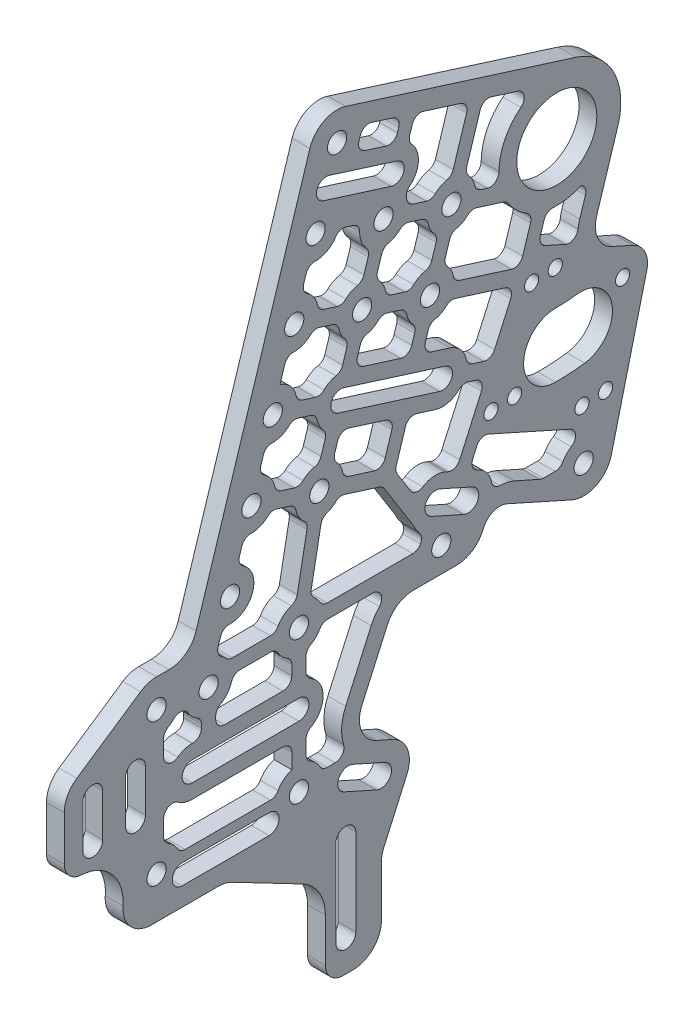
from build123d import *

# Parameters (mm, degrees)
BOSS_EXTRUDE1_DEPTH      = 3.175
BOSS_EXTRUDE1_DEPTH_BACK = 3.175
SKETCH2_R                = 14.2875
SKETCH2_R_2              = 3.429
SKETCH2_R_3              = 2.54
CUT_EXTRUDE2_DEPTH       = 287.611673302
FILLET1_START            = -3.175
FILLET1_DEPTH            = 6.35


with BuildPart() as part:
    # Sketch2 → Boss-Extrude1 (new, two sides: drawn at the far end of the back side and taken through both)
    with BuildSketch(Plane(origin=(0, 0, 0), x_dir=(0, 0, -1), z_dir=(1, 0, 0)).offset(-BOSS_EXTRUDE1_DEPTH_BACK)):
        with BuildLine():
            Line((38.021448917, 246.234864084), (120.241230069, 220.311066665))
            ThreePointArc((120.241230069, 220.311066665), (133.644163138, 209.06467047), (135.169064986, 191.634962595))
            Line((135.169064986, 191.634962595), (127.622152065, 167.6992128))
            ThreePointArc((127.622152065, 167.6992128), (128.044603019, 160.47960856), (133.162508812, 155.36999111))
            Line((133.162508812, 155.36999111), (140.48887895, 152.092017357))
            ThreePointArc((140.48887895, 152.092017357), (144.852236282, 147.866521475), (145.483799346, 141.825426314))
            Line((145.483799346, 141.825426314), (132.821367632, 91.06703794))
            ThreePointArc((132.821367632, 91.06703794), (127.408392323, 84.390132513), (118.814072234, 84.252183312))
            Line((118.814072234, 84.252183312), (95.644233558, 94.61886171))
            ThreePointArc((95.644233558, 94.61886171), (90.786060122, 94.754966448), (87.254572158, 91.415959651))
            Line((87.254572158, 91.415959651), (86.910445683, 90.646826606))
            ThreePointArc((86.910445683, 90.646826606), (83.162135594, 86.27028604), (77.636394916, 84.636234079))
            Line((77.636394916, 84.636234079), (62.21871433, 84.636234079))
            ThreePointArc((62.21871433, 84.636234079), (56.692973652, 83.002182118), (52.944663563, 78.625641552))
            Line((52.944663563, 78.625641552), (43.839685496, 58.275741142))
            ThreePointArc((43.839685496, 58.275741142), (43.621917914, 50.502663645), (48.96432879, 44.852282903))
            Line((48.96432879, 44.852282903), (54.760610519, 42.258903232))
            ThreePointArc((54.760610519, 42.258903232), (60.103021394, 36.60852249), (59.885253813, 28.835444993))
            Line((59.885253813, 28.835444993), (51.685949233, 10.509752126))
            ThreePointArc((51.685949233, 10.509752126), (51.023955621, 8.481811623), (50.8, 6.360344653))
            Line((50.8, 6.360344653), (50.8, -11.7475))
            ThreePointArc((50.8, -11.7475), (47.824204897, -18.931704897), (40.64, -21.9075))
            Line((40.64, -21.9075), (37.1475, -21.9075))
            ThreePointArc((37.1475, -21.9075), (32.657371939, -20.047628061), (30.7975, -15.5575))
            Line((30.7975, -15.5575), (30.7975, 0))
            ThreePointArc((30.7975, 0), (28.552596998, 8.032774411), (22.468409419, 13.737834946))
            Line((22.468409419, 13.737834946), (-2.554479623, 26.788416358))
            ThreePointArc((-2.554479623, 26.788416358), (-4.834094275, 27.647905305), (-7.252780881, 27.94))
            Line((-7.252780881, 27.94), (-31.256978796, 27.94))
            ThreePointArc((-31.256978796, 27.94), (-38.707276299, 31.19213006), (-41.38801938, 38.866561592))
            ThreePointArc((-41.38801938, 38.866561592), (-45.28789684, 50.537792221), (-56.355984579, 55.915905494))
            ThreePointArc((-56.355984579, 55.915905494), (-60.621662669, 57.889989399), (-62.361270294, 62.25654206))
            Line((-62.361270294, 62.25654206), (-62.361270294, 78.164314079))
            ThreePointArc((-62.361270294, 78.164314079), (-61.17251471, 82.933210558), (-57.884425091, 86.586151856))
            Line((-57.884425091, 86.586151856), (-35.119675091, 101.948071856))
            ThreePointArc((-35.119675091, 101.948071856), (-32.408029017, 103.24198088), (-29.436520294, 103.686234079))
            Line((-29.436520294, 103.686234079), (-25.026637608, 103.686234079))
            ThreePointArc((-25.026637608, 103.686234079), (-19.01893158, 105.6527569), (-15.336873388, 110.791063156))
            Line((-15.336873388, 110.791063156), (25.276513775, 239.600270788))
            ThreePointArc((25.276513775, 239.600270788), (30.274912084, 245.55712993), (38.021448917, 246.234864084))
        make_face()
        with Locations((113.367095492, 198.509097171)):
            Circle(SKETCH2_R, mode=Mode.SUBTRACT)
        with Locations((-29.436520294, 42.726234079)):
            Circle(SKETCH2_R_2, mode=Mode.SUBTRACT)
        with Locations((21.363479706, 93.526234079)):
            Circle(SKETCH2_R_2, mode=Mode.SUBTRACT)
        with Locations((122.963479706, 93.526234079)):
            Circle(SKETCH2_R_2, mode=Mode.SUBTRACT)
        with Locations((104.398969727, 158.50014909)):
            Circle(SKETCH2_R_3, mode=Mode.SUBTRACT)
        with Locations((136.858147411, 143.977222936)):
            Circle(SKETCH2_R_3, mode=Mode.SUBTRACT)
        with Locations((122.335221257, 111.518045252)):
            Circle(SKETCH2_R_3, mode=Mode.SUBTRACT)
        with Locations((89.876043573, 126.040971407)):
            Circle(SKETCH2_R_3, mode=Mode.SUBTRACT)
        with Locations((112.840572264, 159.063757816)):
            Circle(SKETCH2_R_3, mode=Mode.SUBTRACT)
        with Locations((130.776823793, 112.081653978)):
            Circle(SKETCH2_R_3, mode=Mode.SUBTRACT)
        with Locations((98.317646109, 126.604580132)):
            Circle(SKETCH2_R_3, mode=Mode.SUBTRACT)
        with Locations((-29.436520294, 93.526234079)):
            Circle(SKETCH2_R_2, mode=Mode.SUBTRACT)
        with Locations((21.363479706, 42.726234079)):
            Circle(SKETCH2_R_2, mode=Mode.SUBTRACT)
        with Locations((72.163479706, 93.526234079)):
            Circle(SKETCH2_R_2, mode=Mode.SUBTRACT)
        with Locations((34.966277994, 236.545099865)):
            Circle(SKETCH2_R_2, mode=Mode.SUBTRACT)
        with Locations((27.328350687, 212.320689316)):
            Circle(SKETCH2_R_2, mode=Mode.SUBTRACT)
        with Locations((19.690423379, 188.096278767)):
            Circle(SKETCH2_R_2, mode=Mode.SUBTRACT)
        with Locations((12.052496072, 163.871868218)):
            Circle(SKETCH2_R_2, mode=Mode.SUBTRACT)
        with Locations((4.414568765, 139.647457669)):
            Circle(SKETCH2_R_2, mode=Mode.SUBTRACT)
        with Locations((-3.223358543, 115.42304712)):
            Circle(SKETCH2_R_2, mode=Mode.SUBTRACT)
        with Locations((-10.86128585, 91.198636571)):
            Circle(SKETCH2_R_2, mode=Mode.SUBTRACT)
        with Locations((51.552761236, 204.682762008)):
            Circle(SKETCH2_R_2, mode=Mode.SUBTRACT)
        with Locations((43.914833928, 180.458351459)):
            Circle(SKETCH2_R_2, mode=Mode.SUBTRACT)
        with Locations((75.777171785, 197.044834701)):
            Circle(SKETCH2_R_2, mode=Mode.SUBTRACT)
        with Locations((68.139244477, 172.820424152)):
            Circle(SKETCH2_R_2, mode=Mode.SUBTRACT)
        with Locations((28.638979314, 132.009530361)):
            Circle(SKETCH2_R_2, mode=Mode.SUBTRACT)
        with BuildLine():
            Line((30.078004517, 221.041477113), (54.302415066, 213.403549806))
            ThreePointArc((54.302415066, 213.403549806), (58.763142366, 215.72565746), (56.441034713, 220.18638476))
            Line((56.441034713, 220.18638476), (32.216624164, 227.824312067))
            ThreePointArc((32.216624164, 227.824312067), (27.755896864, 225.502204413), (30.078004517, 221.041477113))
        make_face(mode=Mode.SUBTRACT)
        with BuildLine():
            Line((41.656, 20.2565), (41.656, -10.7315))
            ThreePointArc((41.656, -10.7315), (38.1, -14.2875), (34.544, -10.7315))
            Line((34.544, -10.7315), (34.544, 20.2565))
            ThreePointArc((34.544, 20.2565), (38.1, 23.8125), (41.656, 20.2565))
        make_face(mode=Mode.SUBTRACT)
        with BuildLine():
            Line((-20.2565, 41.656), (10.7315, 41.656))
            ThreePointArc((10.7315, 41.656), (14.2875, 38.1), (10.7315, 34.544))
            Line((10.7315, 34.544), (-20.2565, 34.544))
            ThreePointArc((-20.2565, 34.544), (-23.8125, 38.1), (-20.2565, 41.656))
        make_face(mode=Mode.SUBTRACT)
        with BuildLine():
            Line((-48.645270294, 78.164314079), (-48.645270294, 62.924314079))
            ThreePointArc((-48.645270294, 62.924314079), (-52.201270294, 59.368314079), (-55.757270294, 62.924314079))
            Line((-55.757270294, 62.924314079), (-55.757270294, 78.164314079))
            ThreePointArc((-55.757270294, 78.164314079), (-52.201270294, 81.720314079), (-48.645270294, 78.164314079))
        make_face(mode=Mode.SUBTRACT)
        with BuildLine():
            Line((-33.405270294, 78.164314079), (-33.405270294, 62.924314079))
            ThreePointArc((-33.405270294, 62.924314079), (-36.961270294, 59.368314079), (-40.517270294, 62.924314079))
            Line((-40.517270294, 62.924314079), (-40.517270294, 78.164314079))
            ThreePointArc((-40.517270294, 78.164314079), (-36.961270294, 81.720314079), (-33.405270294, 78.164314079))
        make_face(mode=Mode.SUBTRACT)
        with BuildLine():
            Line((37.346216444, 159.625358387), (73.682832268, 148.168467426))
            ThreePointArc((73.682832268, 148.168467426), (76.004939921, 143.707740126), (71.544212621, 141.385632472))
            Line((71.544212621, 141.385632472), (35.207596798, 152.842523433))
            ThreePointArc((35.207596798, 152.842523433), (32.885489144, 157.303250733), (37.346216444, 159.625358387))
        make_face(mode=Mode.SUBTRACT)
        with BuildLine():
            Line((-16.736520294, 71.682234079), (21.363479706, 71.682234079))
            ThreePointArc((21.363479706, 71.682234079), (24.919479706, 68.126234079), (21.363479706, 64.570234079))
            Line((21.363479706, 64.570234079), (-16.736520294, 64.570234079))
            ThreePointArc((-16.736520294, 64.570234079), (-20.292520294, 68.126234079), (-16.736520294, 71.682234079))
        make_face(mode=Mode.SUBTRACT)
        with BuildLine():
            Line((71.695223435, 111.204761595), (83.287786894, 106.018002254))
            ThreePointArc((83.287786894, 106.018002254), (85.209528129, 100.984205414), (80.175731289, 99.062464179))
            Line((80.175731289, 99.062464179), (68.583167831, 104.24922352))
            ThreePointArc((68.583167831, 104.24922352), (66.661426596, 109.28302036), (71.695223435, 111.204761595))
        make_face(mode=Mode.SUBTRACT)
        with BuildLine():
            Line((40.57466739, 41.649380844), (52.167230848, 36.462621503))
            ThreePointArc((52.167230848, 36.462621503), (54.088972084, 31.428824663), (49.055175244, 29.507083428))
            Line((49.055175244, 29.507083428), (37.462611785, 34.693842769))
            ThreePointArc((37.462611785, 34.693842769), (35.54087055, 39.727639609), (40.57466739, 41.649380844))
        make_face(mode=Mode.SUBTRACT)
        with BuildLine():
            ThreePointArc((112.879749334, 123.580682042), (118.115569936, 123.729709032), (123.328186485, 124.244155468))
            ThreePointArc((123.328186485, 124.244155468), (133.137248458, 137.092194354), (120.289209572, 146.901256326))
            ThreePointArc((120.289209572, 146.901256326), (116.666882818, 146.543759651), (113.028431213, 146.440198522))
            ThreePointArc((113.028431213, 146.440198522), (101.524332034, 135.084781222), (112.879749334, 123.580682042))
        make_face(mode=Mode.SUBTRACT)
    extrude(amount=BOSS_EXTRUDE1_DEPTH + BOSS_EXTRUDE1_DEPTH_BACK)

    # Sketch4 → Cut-Extrude2 (cut, through all)
    with BuildSketch(Plane(origin=(3.175, 0, 0), x_dir=(0, 0, -1), z_dir=(1, 0, 0))):
        with BuildLine():
            Line((98.39037992, 160.619013807), (75.120636428, 167.955935747))
            ThreePointArc((75.120636428, 167.955935747), (72.068263427, 165.272848972), (68.119638183, 164.31144674))
            Line((68.119638183, 164.31144674), (65.520653509, 156.068520459))
            Line((65.520653509, 156.068520459), (75.210417729, 153.013349536))
            ThreePointArc((75.210417729, 153.013349536), (79.595555225, 149.859540899), (81.24931684, 144.717458413))
            Line((81.24931684, 144.717458413), (90.036119582, 141.94699015))
            Line((90.036119582, 141.94699015), (98.39037992, 160.619013807))
        make_face()
        with BuildLine():
            Line((60.6757714, 157.59610592), (63.274756073, 165.839032202))
            ThreePointArc((63.274756073, 165.839032202), (60.591669298, 168.891405202), (59.630267066, 172.840030446))
            Line((59.630267066, 172.840030446), (50.896225879, 175.593863055))
            ThreePointArc((50.896225879, 175.593863055), (47.843852878, 172.91077628), (43.895227634, 171.949374048))
            Line((43.895227634, 171.949374048), (41.29624296, 163.706447766))
            Line((41.29624296, 163.706447766), (60.6757714, 157.59610592))
        make_face()
        with BuildLine():
            ThreePointArc((73.003732882, 179.801816102), (75.686819657, 176.749443102), (76.648221889, 172.800817857))
            Line((76.648221889, 172.800817857), (100.251556207, 165.358715133))
            Line((100.251556207, 165.358715133), (104.786020489, 179.740198481))
            ThreePointArc((104.786020489, 179.740198481), (99.495233646, 183.229115), (95.512628182, 188.159005223))
            Line((95.512628182, 188.159005223), (82.758563735, 192.180346296))
            ThreePointArc((82.758563735, 192.180346296), (79.706190735, 189.497259521), (75.75756549, 188.535857289))
            Line((75.75756549, 188.535857289), (73.003732882, 179.801816102))
        make_face()
        with BuildLine():
            Line((52.42381134, 180.438745165), (61.157852527, 177.684912556))
            ThreePointArc((61.157852527, 177.684912556), (64.210225527, 180.367999331), (68.158850772, 181.329401564))
            Line((68.158850772, 181.329401564), (70.91268338, 190.063442751))
            ThreePointArc((70.91268338, 190.063442751), (68.229596605, 193.115815751), (67.268194373, 197.064440995))
            Line((67.268194373, 197.064440995), (58.534153186, 199.818273604))
            ThreePointArc((58.534153186, 199.818273604), (55.481780186, 197.135186829), (51.533154941, 196.173784597))
            Line((51.533154941, 196.173784597), (48.779322333, 187.439743409))
            ThreePointArc((48.779322333, 187.439743409), (51.462409108, 184.387370409), (52.42381134, 180.438745165))
        make_face()
        with BuildLine():
            Line((77.435540738, 113.784316645), (87.947554498, 137.278984236))
            Line((87.947554498, 137.278984236), (79.721731379, 139.872576303))
            ThreePointArc((79.721731379, 139.872576303), (75.417671823, 136.608987617), (70.01662716, 136.540750362))
            Line((70.01662716, 136.540750362), (60.32686294, 139.595921285))
            Line((60.32686294, 139.595921285), (55.638222289, 124.725452965))
            Line((55.638222289, 124.725452965), (63.196259353, 112.646211684))
            ThreePointArc((63.196259353, 112.646211684), (67.895557701, 115.934864988), (73.614324392, 115.494010075))
            Line((73.614324392, 115.494010075), (77.435540738, 113.784316645))
        make_face()
        with BuildLine():
            Line((51.204741538, 127.557836839), (55.481980831, 141.123506747))
            Line((55.481980831, 141.123506747), (36.102452391, 147.233848593))
            Line((36.102452391, 147.233848593), (33.503467718, 138.990922311))
            ThreePointArc((33.503467718, 138.990922311), (36.186554493, 135.938549311), (37.147956725, 131.989924067))
            Line((37.147956725, 131.989924067), (51.204741538, 127.557836839))
        make_face()
        with BuildLine():
            Line((36.336498157, 164.869735306), (39.050345524, 173.476959509))
            ThreePointArc((39.050345524, 173.476959509), (36.367258749, 176.529332509), (35.405856517, 180.477957754))
            Line((35.405856517, 180.477957754), (26.67181533, 183.231790362))
            ThreePointArc((26.67181533, 183.231790362), (22.434832876, 180.042006763), (17.131717731, 179.981101233))
            Line((17.131717731, 179.981101233), (14.61120172, 171.987045752))
            ThreePointArc((14.61120172, 171.987045752), (18.920325355, 168.895412976), (20.561473484, 163.852261923))
            Line((20.561473484, 163.852261923), (29.168697687, 161.138414556))
            ThreePointArc((29.168697687, 161.138414556), (32.289245597, 163.894166466), (36.336498157, 164.869735306))
        make_face()
        with BuildLine():
            ThreePointArc((122.056050033, 179.789896461), (115.96602176, 178.035895455), (109.630902598, 178.21261302))
            Line((109.630902598, 178.21261302), (106.658778228, 168.786238815))
            Line((106.658778228, 168.786238815), (120.956635235, 162.389073628))
            ThreePointArc((120.956635235, 162.389073628), (120.860422247, 166.032726124), (121.566049428, 169.608694627))
            Line((121.566049428, 169.608694627), (124.530205964, 179.009798092))
            Line((124.530205964, 179.009798092), (122.056050033, 179.789896461))
        make_face()
        with BuildLine():
            Line((84.286149197, 197.025228406), (93.180003364, 194.221006959))
            ThreePointArc((93.180003364, 194.221006959), (95.373092197, 208.614652657), (106.522348099, 217.97845359))
            Line((106.522348099, 217.97845359), (86.983229243, 224.139114101))
            Line((86.983229243, 224.139114101), (80.641660189, 204.026226651))
            ThreePointArc((80.641660189, 204.026226651), (83.324746964, 200.973853651), (84.286149197, 197.025228406))
        make_face()
        with BuildLine():
            Line((28.658585608, 140.518507773), (31.372432975, 149.125731976))
            ThreePointArc((31.372432975, 149.125731976), (28.616681066, 152.246279886), (27.641112225, 156.293532446))
            Line((27.641112225, 156.293532446), (19.033888022, 159.007379813))
            ThreePointArc((19.033888022, 159.007379813), (14.796905569, 155.817596214), (9.493790424, 155.756690684))
            Line((9.493790424, 155.756690684), (6.973274413, 147.762635203))
            ThreePointArc((6.973274413, 147.762635203), (11.282398048, 144.671002427), (12.923546176, 139.627851374))
            Line((12.923546176, 139.627851374), (21.657587363, 136.874018766))
            ThreePointArc((21.657587363, 136.874018766), (24.709960364, 139.557105541), (28.658585608, 140.518507773))
        make_face()
        with BuildLine():
            Line((28.199400791, 188.076672472), (36.933441978, 185.322839864))
            ThreePointArc((36.933441978, 185.322839864), (39.985814978, 188.005926639), (43.934440223, 188.967328871))
            Line((43.934440223, 188.967328871), (46.688272831, 197.701370058))
            ThreePointArc((46.688272831, 197.701370058), (43.498489232, 201.938352511), (43.437583702, 207.241467656))
            Line((43.437583702, 207.241467656), (35.443528221, 209.761983668))
            ThreePointArc((35.443528221, 209.761983668), (31.257369637, 204.773114136), (24.769645039, 204.205511782))
            Line((24.769645039, 204.205511782), (22.249129027, 196.211456301))
            ThreePointArc((22.249129027, 196.211456301), (26.558252662, 193.119823525), (28.199400791, 188.076672472))
        make_face()
        with BuildLine():
            Line((60.061738648, 204.663155714), (68.795779835, 201.909323105))
            ThreePointArc((68.795779835, 201.909323105), (71.848152835, 204.59240988), (75.796778079, 205.553812113))
            Line((75.796778079, 205.553812113), (82.138347133, 225.666699563))
            Line((82.138347133, 225.666699563), (62.758818694, 231.777041409))
            Line((62.758818694, 231.777041409), (60.276198535, 223.903176217))
            ThreePointArc((60.276198535, 223.903176217), (63.972979357, 216.02106963), (58.928578059, 208.925450682))
            ThreePointArc((58.928578059, 208.925450682), (59.776109798, 206.868996082), (60.061738648, 204.663155714))
        make_face()
        with BuildLine():
            Line((86.123407556, 120.763365611), (82.072566121, 111.709612909))
            Line((82.072566121, 111.709612909), (85.20688785, 110.307250734))
            ThreePointArc((85.20688785, 110.307250734), (89.219725477, 106.581698347), (90.13174549, 101.182547868))
            ThreePointArc((90.13174549, 101.182547868), (94.247844944, 101.466045187), (98.237613228, 100.415143439))
            Line((98.237613228, 100.415143439), (107.957556727, 96.066234079))
            Line((107.957556727, 96.066234079), (114.842427989, 96.066234079))
            ThreePointArc((114.842427989, 96.066234079), (116.263438719, 98.77147304), (118.548531893, 100.800250632))
            ThreePointArc((118.548531893, 100.800250632), (120.069983463, 103.712435435), (118.197853141, 106.412576777))
            Line((118.197853141, 106.412576777), (86.123407556, 120.763365611))
        make_face()
        with BuildLine():
            ThreePointArc((63.906029369, 101.934694281), (62.925863328, 103.213577215), (62.204356677, 104.654304525))
            Line((62.204356677, 104.654304525), (51.206737664, 122.230679508))
            Line((51.206737664, 122.230679508), (35.620371264, 127.145041957))
            ThreePointArc((35.620371264, 127.145041957), (33.008334973, 124.708036533), (29.62615835, 123.557988576))
            Line((29.62615835, 123.557988576), (25.367878871, 101.034087856))
            ThreePointArc((25.367878871, 101.034087856), (27.915313996, 98.955465004), (29.484531424, 96.066234079))
            Line((29.484531424, 96.066234079), (64.042427989, 96.066234079))
            ThreePointArc((64.042427989, 96.066234079), (64.720102377, 97.649244499), (65.702609631, 99.063402928))
            Line((65.702609631, 99.063402928), (63.906029369, 101.934694281))
        make_face()
        with BuildLine():
            ThreePointArc((24.634580149, 124.501676585), (21.337485486, 127.640174701), (20.130001902, 132.029136656))
            Line((20.130001902, 132.029136656), (11.395960715, 134.782969264))
            ThreePointArc((11.395960715, 134.782969264), (7.158978261, 131.593185665), (1.855863117, 131.532280135))
            Line((1.855863117, 131.532280135), (-0.664652895, 123.538224654))
            ThreePointArc((-0.664652895, 123.538224654), (4.891818991, 112.864341472), (-5.782064191, 107.307869586))
            Line((-5.782064191, 107.307869586), (-8.302580202, 99.313814105))
            ThreePointArc((-8.302580202, 99.313814105), (-5.823456736, 98.055994576), (-3.882061288, 96.066234079))
            Line((-3.882061288, 96.066234079), (13.242427989, 96.066234079))
            ThreePointArc((13.242427989, 96.066234079), (15.934248781, 100.078068369), (20.37630067, 101.977775864))
            Line((20.37630067, 101.977775864), (24.634580149, 124.501676585))
        make_face()
        with BuildLine():
            Line((55.546179119, 225.7950596), (57.913936584, 233.30462687))
            Line((57.913936584, 233.30462687), (43.368178906, 237.89088665))
            ThreePointArc((43.368178906, 237.89088665), (43.037225534, 233.850125502), (40.873968492, 230.421189841))
            Line((40.873968492, 230.421189841), (55.546179119, 225.7950596))
        make_face()
        with BuildLine():
            ThreePointArc((47.148381834, 81.219021222), (53.239385728, 88.330899642), (62.21871433, 90.986234079))
            Line((62.21871433, 90.986234079), (29.484531424, 90.986234079))
            ThreePointArc((29.484531424, 90.986234079), (27.380251308, 87.509462478), (23.903479706, 85.405182362))
            Line((23.903479706, 85.405182362), (23.903479706, 76.380257098))
            ThreePointArc((23.903479706, 76.380257098), (29.999479706, 68.126234079), (23.903479706, 59.87221106))
            Line((23.903479706, 59.87221106), (23.903479706, 50.847285797))
            ThreePointArc((23.903479706, 50.847285797), (27.380251308, 48.74300568), (29.484531424, 45.266234079))
            Line((29.484531424, 45.266234079), (39.182521841, 45.266234079))
            ThreePointArc((39.182521841, 45.266234079), (36.64756034, 52.924189545), (38.043403766, 60.869120813))
            Line((38.043403766, 60.869120813), (47.148381834, 81.219021222))
        make_face()
        with BuildLine():
            ThreePointArc((18.823479706, 85.405182362), (15.346708105, 87.509462478), (13.242427989, 90.986234079))
            Line((13.242427989, 90.986234079), (-2.354937269, 90.986234079))
            ThreePointArc((-2.354937269, 90.986234079), (-4.068485442, 86.074093312), (-8.32128585, 83.077584853))
            Line((-8.32128585, 83.077584853), (-8.32128585, 76.762234079))
            Line((-8.32128585, 76.762234079), (18.823479706, 76.762234079))
            Line((18.823479706, 76.762234079), (18.823479706, 85.405182362))
        make_face()
        with BuildLine():
            Line((-13.40128585, 76.762234079), (-13.40128585, 83.077584853))
            ThreePointArc((-13.40128585, 83.077584853), (-16.201569996, 84.574102908), (-18.258291226, 86.992998394))
            ThreePointArc((-18.258291226, 86.992998394), (-20.623606881, 88.574093694), (-23.305909281, 87.625497717))
            ThreePointArc((-23.305909281, 87.625497717), (-24.961330476, 86.289124359), (-26.896520294, 85.405182362))
            Line((-26.896520294, 85.405182362), (-26.896520294, 77.650387375))
            ThreePointArc((-26.896520294, 77.650387375), (-25.156610021, 74.81822522), (-21.843832122, 75.090131113))
            ThreePointArc((-21.843832122, 75.090131113), (-19.423552227, 76.333569541), (-16.736520294, 76.762234079))
            Line((-16.736520294, 76.762234079), (-13.40128585, 76.762234079))
        make_face()
        with BuildLine():
            Line((18.823479706, 50.847285797), (18.823479706, 59.490234079))
            Line((18.823479706, 59.490234079), (-16.736520294, 59.490234079))
            ThreePointArc((-16.736520294, 59.490234079), (-19.423552227, 59.918898617), (-21.843832122, 61.162337046))
            ThreePointArc((-21.843832122, 61.162337046), (-25.156610021, 61.434242939), (-26.896520294, 58.602080783))
            Line((-26.896520294, 58.602080783), (-26.896520294, 50.847285797))
            ThreePointArc((-26.896520294, 50.847285797), (-23.419748692, 48.74300568), (-21.315468576, 45.266234079))
            Line((-21.315468576, 45.266234079), (13.242427989, 45.266234079))
            ThreePointArc((13.242427989, 45.266234079), (15.346708105, 48.74300568), (18.823479706, 50.847285797))
        make_face()
    extrude(amount=-CUT_EXTRUDE2_DEPTH, mode=Mode.SUBTRACT)

    # Fillet1: read off the stored shape, not the designer's step
    # Fillet1 outline → Fillet1 (add)
    with BuildSketch(Plane.YZ.offset(FILLET1_START)):
        with BuildLine():
            ThreePointArc((81.007727337, 8.32128585), (82.612389998, 7.885935964), (83.776996151, 6.699274981))
            ThreePointArc((83.776996151, 6.699274981), (83.385087471, 7.492082463), (83.077584853, 8.32128585))
            Line((83.077584853, 8.32128585), (81.007727337, 8.32128585))
        make_face()
        with BuildLine():
            ThreePointArc((90.986234079, 2.354937269), (89.846753449, 2.460363697), (88.731723887, 2.717734855))
            ThreePointArc((88.731723887, 2.717734855), (90.361055655, 1.570930172), (90.986234079, -0.320903576))
            Line((90.986234079, -0.320903576), (90.986234079, 2.354937269))
        make_face()
        with BuildLine():
            ThreePointArc((76.762234079, 5.14628585), (77.692170049, 7.391349881), (79.937234079, 8.32128585))
            Line((79.937234079, 8.32128585), (76.762234079, 8.32128585))
            Line((76.762234079, 8.32128585), (76.762234079, 5.14628585))
        make_face()
        with BuildLine():
            Line((90.986234079, -13.242427989), (90.986234079, -11.172570473))
            ThreePointArc((90.986234079, -11.172570473), (90.550884193, -12.777233134), (89.36422321, -13.941839287))
            ThreePointArc((89.36422321, -13.941839287), (90.157030692, -13.549930607), (90.986234079, -13.242427989))
        make_face()
        with BuildLine():
            ThreePointArc((79.937234079, -18.823479706), (77.692170049, -17.893543737), (76.762234079, -15.648479706))
            Line((76.762234079, -15.648479706), (76.762234079, -18.823479706))
            Line((76.762234079, -18.823479706), (79.937234079, -18.823479706))
        make_face()
        with BuildLine():
            ThreePointArc((85.405182362, -18.823479706), (85.712684979, -17.994276319), (86.104593659, -17.201468837))
            ThreePointArc((86.104593659, -17.201468837), (84.939987507, -18.38812982), (83.335324846, -18.823479706))
            Line((83.335324846, -18.823479706), (85.405182362, -18.823479706))
        make_face()
        with BuildLine():
            ThreePointArc((83.776996151, 15.02329672), (82.612389998, 13.836635737), (81.007727337, 13.40128585))
            Line((81.007727337, 13.40128585), (83.077584853, 13.40128585))
            ThreePointArc((83.077584853, 13.40128585), (83.385087471, 14.230489238), (83.776996151, 15.02329672))
        make_face()
        with BuildLine():
            ThreePointArc((79.937234079, 13.40128585), (77.692170049, 14.33122182), (76.762234079, 16.57628585))
            Line((76.762234079, 16.57628585), (76.762234079, 13.40128585))
            Line((76.762234079, 13.40128585), (79.937234079, 13.40128585))
        make_face()
        with BuildLine():
            Line((90.986234079, -62.21871433), (90.986234079, -47.738486431))
            ThreePointArc((90.986234079, -47.738486431), (89.086344764, -50.646186165), (85.660427628, -50.07400706))
            ThreePointArc((85.660427628, -50.07400706), (89.596272695, -55.58813877), (90.986234079, -62.21871433))
        make_face()
        with BuildLine():
            ThreePointArc((90.986234079, -29.484531424), (90.157030692, -29.177028806), (89.36422321, -28.785120127))
            ThreePointArc((89.36422321, -28.785120127), (90.550884193, -29.949726279), (90.986234079, -31.55438894))
            Line((90.986234079, -31.55438894), (90.986234079, -29.484531424))
        make_face()
        with BuildLine():
            Line((85.405182362, -23.903479706), (83.335324846, -23.903479706))
            ThreePointArc((83.335324846, -23.903479706), (84.939987507, -24.338829593), (86.104593659, -25.525490576))
            ThreePointArc((86.104593659, -25.525490576), (85.71268498, -24.732683093), (85.405182362, -23.903479706))
        make_face()
        with BuildLine():
            ThreePointArc((76.380257098, -23.903479706), (76.07444242, -24.740827803), (75.683937528, -25.542189384))
            ThreePointArc((75.683937528, -25.542189384), (76.84960336, -24.343671964), (78.462504973, -23.903479706))
            Line((78.462504973, -23.903479706), (76.380257098, -23.903479706))
        make_face()
        with BuildLine():
            Line((59.87221106, -23.903479706), (57.789963185, -23.903479706))
            ThreePointArc((57.789963185, -23.903479706), (59.402864798, -24.343671964), (60.56853063, -25.542189384))
            ThreePointArc((60.56853063, -25.542189384), (60.178025738, -24.740827803), (59.87221106, -23.903479706))
        make_face()
        with BuildLine():
            ThreePointArc((50.847285797, -23.903479706), (50.539783179, -24.732683094), (50.147874499, -25.525490576))
            ThreePointArc((50.147874499, -25.525490576), (51.312480651, -24.338829593), (52.917143312, -23.903479706))
            Line((52.917143312, -23.903479706), (50.847285797, -23.903479706))
        make_face()
        with BuildLine():
            Line((45.266234079, -29.484531424), (45.266234079, -31.55438894))
            ThreePointArc((45.266234079, -31.55438894), (45.701583966, -29.949726279), (46.888244949, -28.785120126))
            ThreePointArc((46.888244949, -28.785120126), (46.095437467, -29.177028806), (45.266234079, -29.484531424))
        make_face()
        with BuildLine():
            ThreePointArc((49.358185626, -37.307254546), (46.547916377, -36.816266415), (45.266234079, -34.267546524))
            Line((45.266234079, -34.267546524), (45.266234079, -39.182521841))
            ThreePointArc((45.266234079, -39.182521841), (47.248002458, -38.104783609), (49.358185626, -37.307254546))
        make_face()
        with BuildLine():
            ThreePointArc((50.847285797, 26.896520294), (50.539783179, 26.067316906), (50.147874499, 25.274509424))
            ThreePointArc((50.147874499, 25.274509424), (51.312480651, 26.461170407), (52.917143312, 26.896520294))
            Line((52.917143312, 26.896520294), (50.847285797, 26.896520294))
        make_face()
        with BuildLine():
            Line((45.266234079, 21.315468576), (45.266234079, 19.24561106))
            ThreePointArc((45.266234079, 19.24561106), (45.701583966, 20.850273721), (46.888244949, 22.014879874))
            ThreePointArc((46.888244949, 22.014879874), (46.095437467, 21.622971194), (45.266234079, 21.315468576))
        make_face()
        with BuildLine():
            ThreePointArc((45.266234079, -13.242427989), (46.095437467, -13.549930607), (46.888244949, -13.941839287))
            ThreePointArc((46.888244949, -13.941839287), (45.701583966, -12.777233134), (45.266234079, -11.172570473))
            Line((45.266234079, -11.172570473), (45.266234079, -13.242427989))
        make_face()
        with BuildLine():
            ThreePointArc((59.490234079, -15.648479706), (58.560298109, -17.893543737), (56.315234079, -18.823479706))
            Line((56.315234079, -18.823479706), (59.490234079, -18.823479706))
            Line((59.490234079, -18.823479706), (59.490234079, -15.648479706))
        make_face()
        with BuildLine():
            ThreePointArc((83.335324846, 26.896520294), (84.939987507, 26.461170407), (86.104593659, 25.274509424))
            ThreePointArc((86.104593659, 25.274509424), (85.712684979, 26.067316907), (85.405182362, 26.896520294))
            Line((85.405182362, 26.896520294), (83.335324846, 26.896520294))
        make_face()
        with BuildLine():
            ThreePointArc((122.537557783, -1.444276728), (124.126326291, -0.195198837), (126.146966854, -0.157880361))
            Line((126.146966854, -0.157880361), (123.538224654, 0.664652895))
            ThreePointArc((123.538224654, 0.664652895), (123.110553002, -0.424289236), (122.537557783, -1.444276728))
        make_face()
        with BuildLine():
            Line((131.532280135, -1.855863117), (128.923537934, -1.03332986))
            ThreePointArc((128.923537934, -1.03332986), (130.557344783, -2.222891179), (131.14234611, -4.157356066))
            ThreePointArc((131.14234611, -4.157356066), (131.258016697, -2.993174671), (131.532280135, -1.855863117))
        make_face()
        with BuildLine():
            ThreePointArc((104.699127385, 6.604597447), (106.332934234, 5.415036128), (106.917935561, 3.480571241))
            ThreePointArc((106.917935561, 3.480571241), (107.033606147, 4.644752636), (107.307869586, 5.782064191))
            Line((107.307869586, 5.782064191), (104.699127385, 6.604597447))
        make_face()
        with BuildLine():
            ThreePointArc((134.782969264, -11.395960715), (134.084611758, -10.853343988), (133.446347037, -10.241172229))
            ThreePointArc((133.446347037, -10.241172229), (134.227881907, -11.708712697), (134.160551105, -13.370018913))
            Line((134.160551105, -13.370018913), (134.782969264, -11.395960715))
        make_face()
        with BuildLine():
            ThreePointArc((98.313147234, 6.193650579), (99.901915742, 7.44272847), (101.922556305, 7.480046946))
            Line((101.922556305, 7.480046946), (99.313814105, 8.302580202))
            ThreePointArc((99.313814105, 8.302580202), (98.886142453, 7.213638072), (98.313147234, 6.193650579))
        make_face()
        with BuildLine():
            Line((132.029136656, -20.130001902), (132.651554815, -18.155943704))
            ThreePointArc((132.651554815, -18.155943704), (131.75382288, -19.555425448), (130.271880362, -20.309294237))
            ThreePointArc((130.271880362, -20.309294237), (131.145843509, -20.173926093), (132.029136656, -20.130001902))
        make_face()
        with BuildLine():
            ThreePointArc((96.066234079, 2.385881357), (96.324082143, 3.639216739), (97.055745626, 4.688980404))
            ThreePointArc((97.055745626, 4.688980404), (96.576146434, 4.266934581), (96.066234079, 3.882061288))
            Line((96.066234079, 3.882061288), (96.066234079, 2.385881357))
        make_face()
        with BuildLine():
            ThreePointArc((124.501676585, -24.634580149), (124.957864116, -23.876933098), (125.49022745, -23.170728172))
            ThreePointArc((125.49022745, -23.170728172), (124.125451776, -24.120390816), (122.467846731, -24.25007233))
            Line((122.467846731, -24.25007233), (124.501676585, -24.634580149))
        make_face()
        with BuildLine():
            ThreePointArc((97.688244949, -13.941839287), (96.501583966, -12.777233134), (96.066234079, -11.172570473))
            Line((96.066234079, -11.172570473), (96.066234079, -13.242427989))
            ThreePointArc((96.066234079, -13.242427989), (96.895437467, -13.549930607), (97.688244949, -13.941839287))
        make_face()
        with BuildLine():
            Line((101.977775864, -20.37630067), (104.011605718, -20.760808488))
            ThreePointArc((104.011605718, -20.760808488), (102.515746527, -20.034945513), (101.591851853, -18.652595915))
            ThreePointArc((101.591851853, -18.652595915), (101.829662858, -19.504406952), (101.977775864, -20.37630067))
        make_face()
        with BuildLine():
            ThreePointArc((137.836133826, -34.840089945), (139.303674294, -34.058555075), (140.96498051, -34.125885877))
            Line((140.96498051, -34.125885877), (138.990922311, -33.503467718))
            ThreePointArc((138.990922311, -33.503467718), (138.448305585, -34.201825223), (137.836133826, -34.840089945))
        make_face()
        with BuildLine():
            Line((147.233848593, -36.102452391), (144.205797274, -35.147711478))
            ThreePointArc((144.205797274, -35.147711478), (146.067315756, -36.70971095), (146.279107679, -39.13050371))
            Line((146.279107679, -39.13050371), (147.233848593, -36.102452391))
        make_face()
        with BuildLine():
            ThreePointArc((131.367505907, -39.122014924), (132.265237842, -37.722533179), (133.747180361, -36.96866439))
            ThreePointArc((133.747180361, -36.96866439), (132.873217214, -37.104032534), (131.989924067, -37.147956725))
            Line((131.989924067, -37.147956725), (131.367505907, -39.122014924))
        make_face()
        with BuildLine():
            Line((141.123506747, -55.481980831), (142.07824766, -52.453929512))
            ThreePointArc((142.07824766, -52.453929512), (140.516248189, -54.315447994), (138.095455428, -54.527239917))
            Line((138.095455428, -54.527239917), (141.123506747, -55.481980831))
        make_face()
        with BuildLine():
            ThreePointArc((130.585888158, -52.159482452), (128.724369676, -50.59748298), (128.512577753, -48.17669022))
            Line((128.512577753, -48.17669022), (127.557836839, -51.204741538))
            Line((127.557836839, -51.204741538), (130.585888158, -52.159482452))
        make_face()
        with BuildLine():
            ThreePointArc((114.900867739, -65.563324581), (114.480570337, -63.156986273), (115.893576634, -61.164368104))
            Line((115.893576634, -61.164368104), (112.646211684, -63.196259353))
            ThreePointArc((112.646211684, -63.196259353), (113.888281541, -64.270499094), (114.900867739, -65.563324581))
        make_face()
        with BuildLine():
            Line((124.725452965, -55.638222289), (123.483655151, -56.415220917))
            ThreePointArc((123.483655151, -56.415220917), (124.766137993, -55.95726755), (126.122506267, -56.078711503))
            Line((126.122506267, -56.078711503), (124.725452965, -55.638222289))
        make_face()
        with BuildLine():
            ThreePointArc((116.68245751, -78.732230573), (115.012954111, -76.966486591), (115.08100648, -74.537399873))
            Line((115.08100648, -74.537399873), (113.784316645, -77.435540738))
            Line((113.784316645, -77.435540738), (116.68245751, -78.732230573))
        make_face()
        with BuildLine():
            Line((139.595921285, -60.32686294), (136.567869967, -59.372122027))
            ThreePointArc((136.567869967, -59.372122027), (138.429388449, -60.934121499), (138.641180372, -63.354914259))
            Line((138.641180372, -63.354914259), (139.595921285, -60.32686294))
        make_face()
        with BuildLine():
            ThreePointArc((138.350651512, -84.548660135), (136.623985605, -86.489954617), (134.025910358, -86.492060087))
            Line((134.025910358, -86.492060087), (137.278984236, -87.947554498))
            Line((137.278984236, -87.947554498), (138.350651512, -84.548660135))
        make_face()
        with BuildLine():
            ThreePointArc((139.872576303, -79.721731379), (139.165943477, -79.178275308), (138.519098439, -78.564870099))
            ThreePointArc((138.519098439, -78.564870099), (139.311622342, -80.0369865), (139.246432291, -81.707606473))
            Line((139.246432291, -81.707606473), (139.872576303, -79.721731379))
        make_face()
        with BuildLine():
            Line((111.709612909, -82.072566121), (110.412923073, -84.970706986))
            ThreePointArc((110.412923073, -84.970706986), (112.178667055, -83.301203587), (114.607753773, -83.369255956))
            Line((114.607753773, -83.369255956), (111.709612909, -82.072566121))
        make_face()
        with BuildLine():
            Line((120.763365611, -86.123407556), (117.865224747, -84.826717721))
            ThreePointArc((117.865224747, -84.826717721), (119.534728145, -86.592461703), (119.466675776, -89.021548421))
            Line((119.466675776, -89.021548421), (120.763365611, -86.123407556))
        make_face()
        with BuildLine():
            ThreePointArc((97.688244949, -115.541839287), (96.501583966, -114.377233134), (96.066234079, -112.772570473))
            Line((96.066234079, -112.772570473), (96.066234079, -114.842427989))
            ThreePointArc((96.066234079, -114.842427989), (96.895437466, -115.149930607), (97.688244949, -115.541839287))
        make_face()
        with BuildLine():
            ThreePointArc((96.066234079, -108.63545805), (96.136220211, -107.972499622), (96.343093214, -107.338768214))
            Line((96.343093214, -107.338768214), (96.066234079, -107.957556727))
            Line((96.066234079, -107.957556727), (96.066234079, -108.63545805))
        make_face()
        with BuildLine():
            ThreePointArc((101.521900861, -93.182189978), (102.263766438, -91.17509556), (104.110726227, -90.094571579))
            ThreePointArc((104.110726227, -90.094571579), (102.648248262, -90.240073481), (101.182547868, -90.13174549))
            ThreePointArc((101.182547868, -90.13174549), (101.444714954, -91.646678427), (101.521900861, -93.182189978))
        make_face()
        with BuildLine():
            ThreePointArc((100.04553699, -26.831730848), (101.410312664, -25.882068204), (103.067917709, -25.75238669))
            Line((103.067917709, -25.75238669), (101.034087856, -25.367878871))
            ThreePointArc((101.034087856, -25.367878871), (100.577900325, -26.125525922), (100.04553699, -26.831730848))
        make_face()
        with BuildLine():
            Line((123.557988576, -29.62615835), (121.524158722, -29.241650532))
            ThreePointArc((121.524158722, -29.241650532), (123.020017914, -29.967513507), (123.943912588, -31.349863105))
            ThreePointArc((123.943912588, -31.349863105), (123.706101582, -30.498052068), (123.557988576, -29.62615835))
        make_face()
        with BuildLine():
            ThreePointArc((96.066234079, -31.55438894), (96.501583966, -29.949726279), (97.688244949, -28.785120126))
            ThreePointArc((97.688244949, -28.785120126), (96.895437466, -29.177028806), (96.066234079, -29.484531424))
            Line((96.066234079, -29.484531424), (96.066234079, -31.55438894))
        make_face()
        with BuildLine():
            ThreePointArc((127.145041957, -35.620371264), (126.446684451, -35.077754537), (125.80841973, -34.465582778))
            ThreePointArc((125.80841973, -34.465582778), (126.5899546, -35.933123246), (126.522623798, -37.594429462))
            Line((126.522623798, -37.594429462), (127.145041957, -35.620371264))
        make_face()
        with BuildLine():
            ThreePointArc((97.649453405, -64.719725235), (96.490367975, -63.557928691), (96.066234079, -61.972570473))
            Line((96.066234079, -61.972570473), (96.066234079, -64.042427989))
            ThreePointArc((96.066234079, -64.042427989), (97.649244499, -64.720102377), (99.063402928, -65.702609631))
            Line((99.063402928, -65.702609631), (100.818082689, -64.604698399))
            ThreePointArc((100.818082689, -64.604698399), (99.249154721, -65.086066524), (97.649453405, -64.719725235))
        make_face()
        with BuildLine():
            Line((122.230679508, -51.206737664), (122.582576394, -50.09066333))
            ThreePointArc((122.582576394, -50.09066333), (122.065547968, -51.078958451), (121.238635277, -51.827464322))
            Line((121.238635277, -51.827464322), (122.230679508, -51.206737664))
        make_face()
        with BuildLine():
            ThreePointArc((144.528923665, -91.191331527), (142.929578105, -89.594576074), (142.797562182, -87.338449749))
            Line((142.797562182, -87.338449749), (141.94699015, -90.036119582))
            Line((141.94699015, -90.036119582), (144.528923665, -91.191331527))
        make_face()
        with BuildLine():
            Line((144.717458413, -81.24931684), (144.091314401, -83.235191935))
            ThreePointArc((144.091314401, -83.235191935), (144.996142087, -81.829308692), (146.489710942, -81.077994568))
            ThreePointArc((146.489710942, -81.077994568), (145.608011734, -81.209451627), (144.717458413, -81.24931684))
        make_face()
        with BuildLine():
            ThreePointArc((161.690681083, -94.991485558), (159.964015175, -96.932780039), (157.365939929, -96.934885509))
            Line((157.365939929, -96.934885509), (160.619013807, -98.39037992))
            Line((160.619013807, -98.39037992), (161.690681083, -94.991485558))
        make_face()
        with BuildLine():
            ThreePointArc((166.61931352, -73.965847942), (167.40084839, -75.43338841), (167.333517588, -77.094694626))
            Line((167.333517588, -77.094694626), (167.955935747, -75.120636428))
            ThreePointArc((167.955935747, -75.120636428), (167.257578241, -74.578019701), (166.61931352, -73.965847942))
        make_face()
        with BuildLine():
            Line((156.068520459, -65.520653509), (155.113779545, -68.548704828))
            ThreePointArc((155.113779545, -68.548704828), (156.675779017, -66.687186346), (159.096571777, -66.475394423))
            Line((159.096571777, -66.475394423), (156.068520459, -65.520653509))
        make_face()
        with BuildLine():
            ThreePointArc((162.337388542, -67.497220024), (163.736870286, -68.394951958), (164.490739075, -69.876894477))
            ThreePointArc((164.490739075, -69.876894477), (164.355370932, -69.00293133), (164.31144674, -68.119638183))
            Line((164.31144674, -68.119638183), (162.337388542, -67.497220024))
        make_face()
        with BuildLine():
            ThreePointArc((166.853142725, -120.950376826), (164.503820993, -119.348181874), (164.379828947, -116.507237095))
            Line((164.379828947, -116.507237095), (162.389073628, -120.956635235))
            ThreePointArc((162.389073628, -120.956635235), (164.620895678, -120.801932509), (166.853142725, -120.950376826))
        make_face()
        with BuildLine():
            Line((168.786238815, -106.658778228), (167.631026871, -109.240711743))
            ThreePointArc((167.631026871, -109.240711743), (169.227782324, -107.641366183), (171.483908649, -107.50935026))
            Line((171.483908649, -107.50935026), (168.786238815, -106.658778228))
        make_face()
        with BuildLine():
            ThreePointArc((179.789896461, -122.056050033), (178.188762665, -123.502532812), (176.032837446, -123.591573878))
            Line((176.032837446, -123.591573878), (179.009798092, -124.530205964))
            Line((179.009798092, -124.530205964), (179.789896461, -122.056050033))
        make_face()
        with BuildLine():
            Line((178.21261302, -109.630902598), (175.698678514, -108.838262093))
            ThreePointArc((175.698678514, -108.838262093), (177.362317543, -110.070565245), (177.912625544, -112.066417689))
            ThreePointArc((177.912625544, -112.066417689), (178.026387597, -110.844197411), (178.21261302, -109.630902598))
        make_face()
        with BuildLine():
            ThreePointArc((166.993820687, -61.938133846), (165.526280219, -62.719668716), (163.864974003, -62.652337914))
            Line((163.864974003, -62.652337914), (165.839032202, -63.274756073))
            ThreePointArc((165.839032202, -63.274756073), (166.381648928, -62.576398568), (166.993820687, -61.938133846))
        make_face()
        with BuildLine():
            Line((157.59610592, -60.6757714), (160.624157239, -61.630512313))
            ThreePointArc((160.624157239, -61.630512313), (158.762638757, -60.068512841), (158.550846834, -57.647720081))
            Line((158.550846834, -57.647720081), (157.59610592, -60.6757714))
        make_face()
        with BuildLine():
            ThreePointArc((173.462448606, -57.656208867), (172.564716671, -59.055690612), (171.082774152, -59.809559401))
            ThreePointArc((171.082774152, -59.809559401), (171.956737299, -59.674191257), (172.840030446, -59.630267066))
            Line((172.840030446, -59.630267066), (173.462448606, -57.656208867))
        make_face()
        with BuildLine():
            Line((163.706447766, -41.29624296), (162.751706853, -44.324294279))
            ThreePointArc((162.751706853, -44.324294279), (164.313706324, -42.462775797), (166.734499085, -42.250983874))
            Line((166.734499085, -42.250983874), (163.706447766, -41.29624296))
        make_face()
        with BuildLine():
            ThreePointArc((174.257240828, -49.741437393), (175.038775698, -51.208977861), (174.971444896, -52.870284077))
            Line((174.971444896, -52.870284077), (175.593863055, -50.896225879))
            ThreePointArc((175.593863055, -50.896225879), (174.895505549, -50.353609152), (174.257240828, -49.741437393))
        make_face()
        with BuildLine():
            Line((171.949374048, -43.895227634), (169.975315849, -43.272809475))
            ThreePointArc((169.975315849, -43.272809475), (171.374797594, -44.170541409), (172.128666382, -45.652483928))
            ThreePointArc((172.128666382, -45.652483928), (171.99329824, -44.77852078), (171.949374048, -43.895227634))
        make_face()
        with BuildLine():
            ThreePointArc((194.199726398, -50.910736782), (195.599208142, -51.808468716), (196.353076931, -53.290411235))
            ThreePointArc((196.353076931, -53.290411235), (196.217708788, -52.416448087), (196.173784597, -51.533154941))
            Line((196.173784597, -51.533154941), (194.199726398, -50.910736782))
        make_face()
        with BuildLine():
            ThreePointArc((199.818273604, -58.534153186), (199.119916098, -57.991536459), (198.481651377, -57.3793647))
            ThreePointArc((198.481651377, -57.3793647), (199.263186247, -58.846905168), (199.195855445, -60.508211384))
            Line((199.195855445, -60.508211384), (199.818273604, -58.534153186))
        make_face()
        with BuildLine():
            ThreePointArc((186.284954924, -50.11594456), (187.752495392, -49.33440969), (189.413801608, -49.401740492))
            Line((189.413801608, -49.401740492), (187.439743409, -48.779322333))
            ThreePointArc((187.439743409, -48.779322333), (186.897126683, -49.477679838), (186.284954924, -50.11594456))
        make_face()
        with BuildLine():
            Line((197.064440995, -67.268194373), (197.686859155, -65.294136175))
            ThreePointArc((197.686859155, -65.294136175), (196.78912722, -66.693617919), (195.307184701, -67.447486708))
            ThreePointArc((195.307184701, -67.447486708), (196.181147848, -67.312118564), (197.064440995, -67.268194373))
        make_face()
        with BuildLine():
            ThreePointArc((179.816327005, -54.397869538), (180.71405894, -52.998387794), (182.196001459, -52.244519005))
            ThreePointArc((182.196001459, -52.244519005), (181.322038312, -52.379887149), (180.438745165, -52.42381134))
            Line((180.438745165, -52.42381134), (179.816327005, -54.397869538))
        make_face()
        with BuildLine():
            ThreePointArc((190.063442751, -70.91268338), (190.606059477, -70.214325875), (191.218231236, -69.576061153))
            ThreePointArc((191.218231236, -69.576061153), (189.750690768, -70.357596023), (188.089384552, -70.290265221))
            Line((188.089384552, -70.290265221), (190.063442751, -70.91268338))
        make_face()
        with BuildLine():
            ThreePointArc((179.021534783, -62.312641013), (178.239999913, -60.845100545), (178.307330715, -59.183794329))
            Line((178.307330715, -59.183794329), (177.684912556, -61.157852527))
            ThreePointArc((177.684912556, -61.157852527), (178.383270062, -61.700469254), (179.021534783, -62.312641013))
        make_face()
        with BuildLine():
            Line((181.329401564, -68.158850772), (183.303459762, -68.781268931))
            ThreePointArc((183.303459762, -68.781268931), (181.903978018, -67.883536997), (181.150109229, -66.401594478))
            ThreePointArc((181.150109229, -66.401594478), (181.285477372, -67.275557625), (181.329401564, -68.158850772))
        make_face()
        with BuildLine():
            ThreePointArc((174.631747995, -37.713723297), (173.164207527, -38.495258167), (171.502901311, -38.427927365))
            Line((171.502901311, -38.427927365), (173.476959509, -39.050345524))
            ThreePointArc((173.476959509, -39.050345524), (174.019576236, -38.351988018), (174.631747995, -37.713723297))
        make_face()
        with BuildLine():
            Line((164.869735306, -36.336498157), (166.8556104, -36.962642169))
            ThreePointArc((166.8556104, -36.962642169), (165.449727157, -36.057814482), (164.698413033, -34.564245628))
            ThreePointArc((164.698413033, -34.564245628), (164.829870093, -35.445944836), (164.869735306, -36.336498157))
        make_face()
        with BuildLine():
            ThreePointArc((181.100375913, -33.431798318), (180.202643978, -34.831280063), (178.72070146, -35.585148852))
            ThreePointArc((178.72070146, -35.585148852), (179.594664607, -35.449780708), (180.477957754, -35.405856517))
            Line((180.477957754, -35.405856517), (181.100375913, -33.431798318))
        make_face()
        with BuildLine():
            ThreePointArc((161.138414556, -29.168697687), (161.845047383, -29.712153758), (162.49189242, -30.325558967))
            ThreePointArc((162.49189242, -30.325558967), (161.699368517, -28.853442565), (161.764558568, -27.182822592))
            Line((161.764558568, -27.182822592), (161.138414556, -29.168697687))
        make_face()
        with BuildLine():
            ThreePointArc((181.895168135, -25.517026844), (182.676703005, -26.984567312), (182.609372203, -28.645873528))
            Line((182.609372203, -28.645873528), (183.231790362, -26.67181533))
            ThreePointArc((183.231790362, -26.67181533), (182.533432857, -26.129198603), (181.895168135, -25.517026844))
        make_face()
        with BuildLine():
            Line((163.852261923, -20.561473484), (163.229843764, -22.535531682))
            ThreePointArc((163.229843764, -22.535531682), (164.127575699, -21.136049938), (165.609518217, -20.382181149))
            ThreePointArc((165.609518217, -20.382181149), (164.73555507, -20.517549292), (163.852261923, -20.561473484))
        make_face()
        with BuildLine():
            ThreePointArc((177.372359032, -16.309184475), (179.006165882, -17.498745794), (179.591167208, -19.433210681))
            ThreePointArc((179.591167208, -19.433210681), (179.706837794, -18.269029286), (179.981101233, -17.131717731))
            Line((179.981101233, -17.131717731), (177.372359032, -16.309184475))
        make_face()
        with BuildLine():
            ThreePointArc((195.21078943, -24.35805865), (196.799557938, -23.108980759), (198.820198501, -23.071662284))
            Line((198.820198501, -23.071662284), (196.211456301, -22.249129027))
            ThreePointArc((196.211456301, -22.249129027), (195.783784649, -23.338071158), (195.21078943, -24.35805865))
        make_face()
        with BuildLine():
            Line((204.205511782, -24.769645039), (201.596769581, -23.947111782))
            ThreePointArc((201.596769581, -23.947111782), (203.230576431, -25.136673101), (203.815577757, -27.071137989))
            ThreePointArc((203.815577757, -27.071137989), (203.931248343, -25.906956594), (204.205511782, -24.769645039))
        make_face()
        with BuildLine():
            ThreePointArc((187.454254313, -30.173458989), (188.351986248, -28.773977245), (189.833928766, -28.020108456))
            ThreePointArc((189.833928766, -28.020108456), (188.959965619, -28.155476599), (188.076672472, -28.199400791))
            Line((188.076672472, -28.199400791), (187.454254313, -30.173458989))
        make_face()
        with BuildLine():
            ThreePointArc((209.761983668, -35.443528221), (208.673041537, -35.015856569), (207.653054045, -34.44286135))
            ThreePointArc((207.653054045, -34.44286135), (208.902131936, -36.031629859), (208.939450411, -38.052270421))
            Line((208.939450411, -38.052270421), (209.761983668, -35.443528221))
        make_face()
        with BuildLine():
            ThreePointArc((186.659462091, -38.088230464), (185.877927221, -36.620689996), (185.945258023, -34.95938378))
            Line((185.945258023, -34.95938378), (185.322839864, -36.933441978))
            ThreePointArc((185.322839864, -36.933441978), (186.02119737, -37.476058705), (186.659462091, -38.088230464))
        make_face()
        with BuildLine():
            Line((207.241467656, -43.437583702), (208.064000913, -40.828841501))
            ThreePointArc((208.064000913, -40.828841501), (206.874439594, -42.462648351), (204.939974707, -43.047649677))
            ThreePointArc((204.939974707, -43.047649677), (206.104156102, -43.163320263), (207.241467656, -43.437583702))
        make_face()
        with BuildLine():
            ThreePointArc((190.941387069, -44.556858382), (189.541905325, -43.659126448), (188.788036536, -42.177183929))
            ThreePointArc((188.788036536, -42.177183929), (188.92340468, -43.051147076), (188.967328871, -43.934440223))
            Line((188.967328871, -43.934440223), (190.941387069, -44.556858382))
        make_face()
        with BuildLine():
            ThreePointArc((197.701370058, -46.688272831), (198.243986785, -45.989915325), (198.856158544, -45.351650604))
            ThreePointArc((198.856158544, -45.351650604), (197.388618076, -46.133185474), (195.72731186, -46.065854672))
            Line((195.72731186, -46.065854672), (197.701370058, -46.688272831))
        make_face()
        with BuildLine():
            ThreePointArc((178.647027617, -74.340355109), (180.114568085, -73.558820239), (181.7758743, -73.626151041))
            Line((181.7758743, -73.626151041), (179.801816102, -73.003732882))
            ThreePointArc((179.801816102, -73.003732882), (179.259199376, -73.702090387), (178.647027617, -74.340355109))
        make_face()
        with BuildLine():
            Line((188.535857289, -75.75756549), (186.561799091, -75.135147331))
            ThreePointArc((186.561799091, -75.135147331), (187.961280835, -76.032879266), (188.715149624, -77.514821784))
            ThreePointArc((188.715149624, -77.514821784), (188.57978148, -76.640858637), (188.535857289, -75.75756549))
        make_face()
        with BuildLine():
            ThreePointArc((172.178399698, -78.622280087), (173.076131633, -77.222798343), (174.558074151, -76.468929554))
            ThreePointArc((174.558074151, -76.468929554), (173.684111004, -76.604297698), (172.800817857, -76.648221889))
            Line((172.800817857, -76.648221889), (172.178399698, -78.622280087))
        make_face()
        with BuildLine():
            ThreePointArc((192.180346296, -82.758563735), (191.48198879, -82.215947008), (190.843724069, -81.603775249))
            ThreePointArc((190.843724069, -81.603775249), (191.625258939, -83.071315717), (191.557928137, -84.732621933))
            Line((191.557928137, -84.732621933), (192.180346296, -82.758563735))
        make_face()
        with BuildLine():
            ThreePointArc((168.386766452, -101.20629712), (166.52524797, -99.644297648), (166.313456047, -97.223504888))
            Line((166.313456047, -97.223504888), (165.358715133, -100.251556207))
            Line((165.358715133, -100.251556207), (168.386766452, -101.20629712))
        make_face()
        with BuildLine():
            Line((188.159005223, -95.512628182), (188.514241375, -94.385963048))
            ThreePointArc((188.514241375, -94.385963048), (188.016079707, -95.349628598), (187.222577672, -96.089338582))
            ThreePointArc((187.222577672, -96.089338582), (187.686949166, -95.794744517), (188.159005223, -95.512628182))
        make_face()
        with BuildLine():
            ThreePointArc((180.891417194, -102.618897575), (179.295857338, -103.938160483), (177.226263976, -103.993379984))
            Line((177.226263976, -103.993379984), (179.740198481, -104.786020489))
            ThreePointArc((179.740198481, -104.786020489), (180.28356886, -103.685333047), (180.891417194, -102.618897575))
        make_face()
        with BuildLine():
            ThreePointArc((138.210640993, -22.812375849), (137.429106123, -21.344835381), (137.496436925, -19.683529165))
            Line((137.496436925, -19.683529165), (136.874018766, -21.657587363))
            ThreePointArc((136.874018766, -21.657587363), (137.572376272, -22.20020409), (138.210640993, -22.812375849))
        make_face()
        with BuildLine():
            Line((139.627851374, -12.923546176), (139.005433215, -14.897604375))
            ThreePointArc((139.005433215, -14.897604375), (139.903165149, -13.49812263), (141.385107668, -12.744253841))
            ThreePointArc((141.385107668, -12.744253841), (140.511144521, -12.879621985), (139.627851374, -12.923546176))
        make_face()
        with BuildLine():
            ThreePointArc((142.492565971, -29.281003767), (141.093084227, -28.383271833), (140.339215438, -26.901329314))
            ThreePointArc((140.339215438, -26.901329314), (140.474583581, -27.775292461), (140.518507773, -28.658585608))
            Line((140.518507773, -28.658585608), (142.492565971, -29.281003767))
        make_face()
        with BuildLine():
            ThreePointArc((147.762635203, -6.973274413), (147.334963551, -8.062216544), (146.761968332, -9.082204036))
            ThreePointArc((146.761968332, -9.082204036), (148.35073684, -7.833126145), (150.371377403, -7.795807669))
            Line((150.371377403, -7.795807669), (147.762635203, -6.973274413))
        make_face()
        with BuildLine():
            ThreePointArc((150.282593256, -30.018955111), (148.810476855, -30.811479014), (147.139856882, -30.746288963))
            Line((147.139856882, -30.746288963), (149.125731976, -31.372432975))
            ThreePointArc((149.125731976, -31.372432975), (149.669188047, -30.665800149), (150.282593256, -30.018955111))
        make_face()
        with BuildLine():
            Line((155.756690684, -9.493790424), (153.147948483, -8.671257168))
            ThreePointArc((153.147948483, -8.671257168), (154.781755333, -9.860818486), (155.366756659, -11.795283374))
            ThreePointArc((155.366756659, -11.795283374), (155.482427245, -10.631101979), (155.756690684, -9.493790424))
        make_face()
        with BuildLine():
            ThreePointArc((156.919676458, -25.655237131), (156.014848772, -27.061120374), (154.521279917, -27.812434498))
            ThreePointArc((154.521279917, -27.812434498), (155.402979125, -27.680977438), (156.293532446, -27.641112225))
            Line((156.293532446, -27.641112225), (156.919676458, -25.655237131))
        make_face()
        with BuildLine():
            ThreePointArc((159.007379813, -19.033888022), (158.309022308, -18.491271296), (157.670757586, -17.879099537))
            ThreePointArc((157.670757586, -17.879099537), (158.452292456, -19.346640005), (158.384961654, -21.00794622))
            Line((158.384961654, -21.00794622), (159.007379813, -19.033888022))
        make_face()
        with BuildLine():
            ThreePointArc((220.187432441, -99.516362257), (217.736458741, -101.683737039), (214.672676596, -100.535684563))
            ThreePointArc((214.672676596, -100.535684563), (216.575268993, -103.391132282), (217.97845359, -106.522348099))
            Line((217.97845359, -106.522348099), (220.187432441, -99.516362257))
        make_face()
        with BuildLine():
            ThreePointArc((194.221006959, -93.180003364), (196.43250741, -92.834336758), (198.668436165, -92.730210617))
            ThreePointArc((198.668436165, -92.730210617), (196.125259672, -91.422814855), (195.664898537, -88.600564338))
            Line((195.664898537, -88.600564338), (194.221006959, -93.180003364))
        make_face()
        with BuildLine():
            ThreePointArc((221.111062783, -86.02848833), (222.972581265, -87.590487801), (223.184373188, -90.011280562))
            Line((223.184373188, -90.011280562), (224.139114101, -86.983229243))
            Line((224.139114101, -86.983229243), (221.111062783, -86.02848833))
        make_face()
        with BuildLine():
            Line((197.025228406, -84.286149197), (196.402810247, -86.260207395))
            ThreePointArc((196.402810247, -86.260207395), (197.300542182, -84.860725651), (198.7824847, -84.106856862))
            ThreePointArc((198.7824847, -84.106856862), (197.908521553, -84.242225005), (197.025228406, -84.286149197))
        make_face()
        with BuildLine():
            ThreePointArc((202.871438166, -81.978282416), (204.338978634, -81.196747546), (206.000284849, -81.264078348))
            Line((206.000284849, -81.264078348), (204.026226651, -80.641660189))
            ThreePointArc((204.026226651, -80.641660189), (203.483609925, -81.340017694), (202.871438166, -81.978282416))
        make_face()
        with BuildLine():
            ThreePointArc((207.527870311, -76.419196239), (206.128388567, -75.521464304), (205.374519778, -74.039521785))
            ThreePointArc((205.374519778, -74.039521785), (205.509887921, -74.913484932), (205.553812113, -75.796778079))
            Line((205.553812113, -75.796778079), (207.527870311, -76.419196239))
        make_face()
        with BuildLine():
            ThreePointArc((201.909323105, -68.795779835), (202.60768061, -69.338396561), (203.245945332, -69.95056832))
            ThreePointArc((203.245945332, -69.95056832), (202.464410462, -68.483027852), (202.531741264, -66.821721636))
            Line((202.531741264, -66.821721636), (201.909323105, -68.795779835))
        make_face()
        with BuildLine():
            ThreePointArc((226.621440476, -79.110295815), (225.059441005, -80.971814297), (222.638648244, -81.18360622))
            Line((222.638648244, -81.18360622), (225.666699563, -82.138347133))
            Line((225.666699563, -82.138347133), (226.621440476, -79.110295815))
        make_face()
        with BuildLine():
            Line((204.663155714, -60.061738648), (204.040737554, -62.035796846))
            ThreePointArc((204.040737554, -62.035796846), (204.938469489, -60.636315101), (206.420412008, -59.882446313))
            ThreePointArc((206.420412008, -59.882446313), (205.546448861, -60.017814456), (204.663155714, -60.061738648))
        make_face()
        with BuildLine():
            ThreePointArc((228.74899009, -61.804077781), (230.610508572, -63.366077252), (230.822300495, -65.786870013))
            Line((230.822300495, -65.786870013), (231.777041409, -62.758818694))
            Line((231.777041409, -62.758818694), (228.74899009, -61.804077781))
        make_face()
        with BuildLine():
            ThreePointArc((208.925450682, -58.928578059), (207.914666029, -59.424093868), (206.847315573, -59.781843133))
            ThreePointArc((206.847315573, -59.781843133), (208.635167848, -59.832484455), (210.111969348, -60.841462964))
            ThreePointArc((210.111969348, -60.841462964), (209.456118464, -59.923844616), (208.925450682, -58.928578059))
        make_face()
        with BuildLine():
            ThreePointArc((222.746314937, -61.629676399), (224.218431338, -60.837152496), (225.889051311, -60.902342548))
            Line((225.889051311, -60.902342548), (223.903176217, -60.276198535))
            ThreePointArc((223.903176217, -60.276198535), (223.359720146, -60.982831361), (222.746314937, -61.629676399))
        make_face()
        with BuildLine():
            ThreePointArc((229.165932444, -44.855136329), (230.836212786, -42.939845366), (233.376352268, -42.863247012))
            ThreePointArc((233.376352268, -42.863247012), (231.793502378, -42.02498909), (230.421189841, -40.873968492))
            Line((230.421189841, -40.873968492), (229.165932444, -44.855136329))
        make_face()
        with BuildLine():
            ThreePointArc((237.89088665, -43.368178906), (236.152843478, -43.466231872), (234.431218075, -43.208521911))
            ThreePointArc((234.431218075, -43.208521911), (236.417821761, -44.741918915), (236.670507532, -47.238726972))
            Line((236.670507532, -47.238726972), (237.89088665, -43.368178906))
        make_face()
        with BuildLine():
            ThreePointArc((228.823110919, -56.500920033), (226.961592437, -54.938920561), (226.749800514, -52.5181278))
            Line((226.749800514, -52.5181278), (225.7950596, -55.546179119))
            Line((225.7950596, -55.546179119), (228.823110919, -56.500920033))
        make_face()
        with BuildLine():
            Line((233.30462687, -57.913936584), (234.259367784, -54.885885266))
            ThreePointArc((234.259367784, -54.885885266), (232.697368312, -56.747403748), (230.276575552, -56.959195671))
            Line((230.276575552, -56.959195671), (233.30462687, -57.913936584))
        make_face()
    extrude(amount=FILLET1_DEPTH)


solid = part.part
